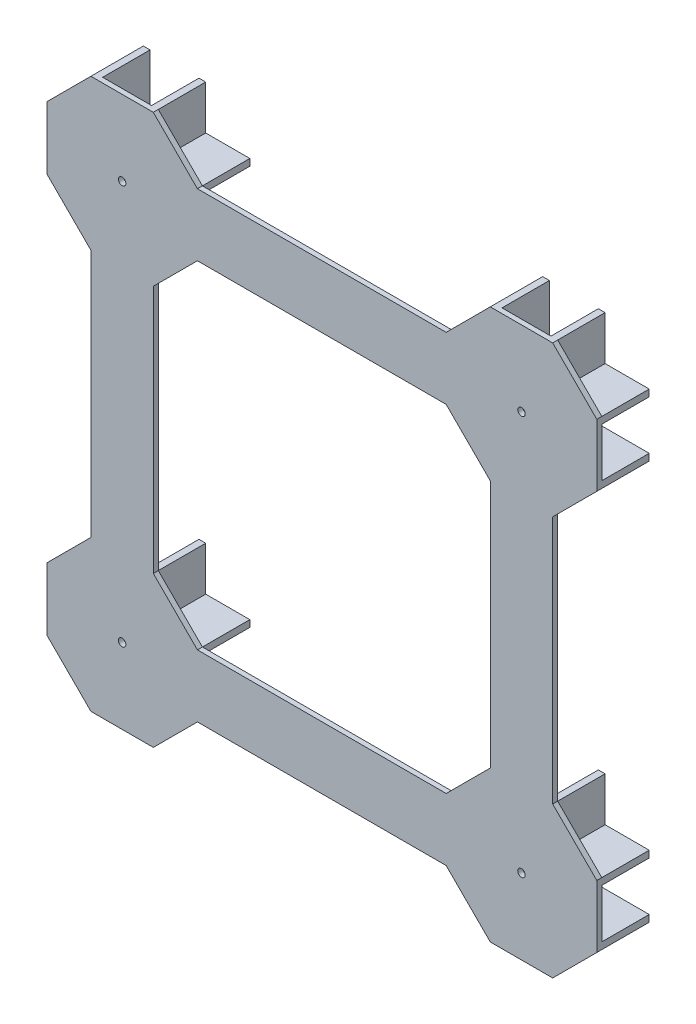
from build123d import *

# Parameters (mm, degrees)
BOSS_EXTRUDE1_DEPTH = 2
BOSS_EXTRUDE2_DEPTH = 19
SKETCH6_R           = 1.5
CUT_EXTRUDE1_DEPTH  = 221.788733523


with BuildPart() as part:
    # Sketch1 → Boss-Extrude1 (new body)
    with BuildSketch(Plane.XY):
        Polygon((-12.5, -110.17766953), (12.5, -110.17766953), (30.17766953, -92.5), (30.17766953, -67.5), (12.5, -49.82233047), (12.5, 49.82233047), (30.17766953, 67.5), (30.17766953, 92.5), (12.5, 110.17766953), (-12.5, 110.17766953), (-30.17766953, 92.5), (-129.82233047, 92.5), (-147.5, 110.17766953), (-172.5, 110.17766953), (-190.17766953, 92.5), (-190.17766953, 67.5), (-172.5, 49.82233047), (-172.5, -49.82233047), (-190.17766953, -67.5), (-190.17766953, -92.5), (-172.5, -110.17766953), (-147.5, -110.17766953), (-129.82233047, -92.5), (-30.17766953, -92.5), align=None)
        Polygon((-30.17766953, -67.5), (-129.82233047, -67.5), (-147.5, -49.82233047), (-147.5, 49.82233047), (-129.82233047, 67.5), (-30.17766953, 67.5), (-12.5, 49.82233047), (-12.5, -49.82233047), align=None, mode=Mode.SUBTRACT)
    extrude(amount=BOSS_EXTRUDE1_DEPTH)

    # Sketch2 → Boss-Extrude2 (add)
    with BuildSketch(Plane(origin=(0, 0, 0), x_dir=(-1, 0, 0), z_dir=(0, 0, -1))):
        Polygon((30.17766953, -67.5), (12.5, -67.5), (12.5, -49.82233047), (9.8, -49.82233047), (9.8, -70.2), (30.17766953, -70.2), align=None)
        Polygon((12.5, -92.5), (30.17766953, -92.5), (30.17766953, -89.8), (9.8, -89.8), (9.8, -110.17766953), (12.5, -110.17766953), align=None)
        Polygon((-12.5, -92.5), (-12.5, -110.17766953), (-9.8, -110.17766953), (-9.8, -89.8), (-30.17766953, -89.8), (-30.17766953, -92.5), align=None)
        Polygon((-12.5, -67.5), (-30.17766953, -67.5), (-30.17766953, -70.2), (-9.8, -70.2), (-9.8, -49.82233047), (-12.5, -49.82233047), align=None)
        Polygon((190.17766953, -67.5), (172.5, -67.5), (172.5, -49.82233047), (169.8, -49.82233047), (169.8, -70.2), (190.17766953, -70.2), align=None)
        Polygon((172.5, -92.5), (190.17766953, -92.5), (190.17766953, -89.8), (169.8, -89.8), (169.8, -110.17766953), (172.5, -110.17766953), align=None)
        Polygon((147.5, -92.5), (147.5, -110.17766953), (150.2, -110.17766953), (150.2, -89.8), (129.82233047, -89.8), (129.82233047, -92.5), align=None)
        Polygon((147.5, -67.5), (129.82233047, -67.5), (129.82233047, -70.2), (150.2, -70.2), (150.2, -49.82233047), (147.5, -49.82233047), align=None)
        Polygon((190.17766953, 92.5), (172.5, 92.5), (172.5, 110.17766953), (169.8, 110.17766953), (169.8, 89.8), (190.17766953, 89.8), align=None)
        Polygon((172.5, 67.5), (190.17766953, 67.5), (190.17766953, 70.2), (169.8, 70.2), (169.8, 49.82233047), (172.5, 49.82233047), align=None)
        Polygon((147.5, 67.5), (147.5, 49.82233047), (150.2, 49.82233047), (150.2, 70.2), (129.82233047, 70.2), (129.82233047, 67.5), align=None)
        Polygon((147.5, 92.5), (129.82233047, 92.5), (129.82233047, 89.8), (150.2, 89.8), (150.2, 110.17766953), (147.5, 110.17766953), align=None)
        Polygon((30.17766953, 92.5), (12.5, 92.5), (12.5, 110.17766953), (9.8, 110.17766953), (9.8, 89.8), (30.17766953, 89.8), align=None)
        Polygon((12.5, 67.5), (30.17766953, 67.5), (30.17766953, 70.2), (9.8, 70.2), (9.8, 49.82233047), (12.5, 49.82233047), align=None)
        Polygon((-12.5, 67.5), (-12.5, 49.82233047), (-9.8, 49.82233047), (-9.8, 70.2), (-30.17766953, 70.2), (-30.17766953, 67.5), align=None)
        Polygon((-12.5, 92.5), (-30.17766953, 92.5), (-30.17766953, 89.8), (-9.8, 89.8), (-9.8, 110.17766953), (-12.5, 110.17766953), align=None)
    extrude(amount=BOSS_EXTRUDE2_DEPTH)

    # Sketch6 → Cut-Extrude1 (cut, through all)
    with BuildSketch(Plane.XY.offset(2)):
        with Locations((-160, 80)):
            Circle(SKETCH6_R)
        with Locations((0, 80)):
            Circle(SKETCH6_R)
        with Locations((-160, -80)):
            Circle(SKETCH6_R)
        with Locations((0, -80)):
            Circle(SKETCH6_R)
    extrude(amount=-CUT_EXTRUDE1_DEPTH, mode=Mode.SUBTRACT)


solid = part.part
